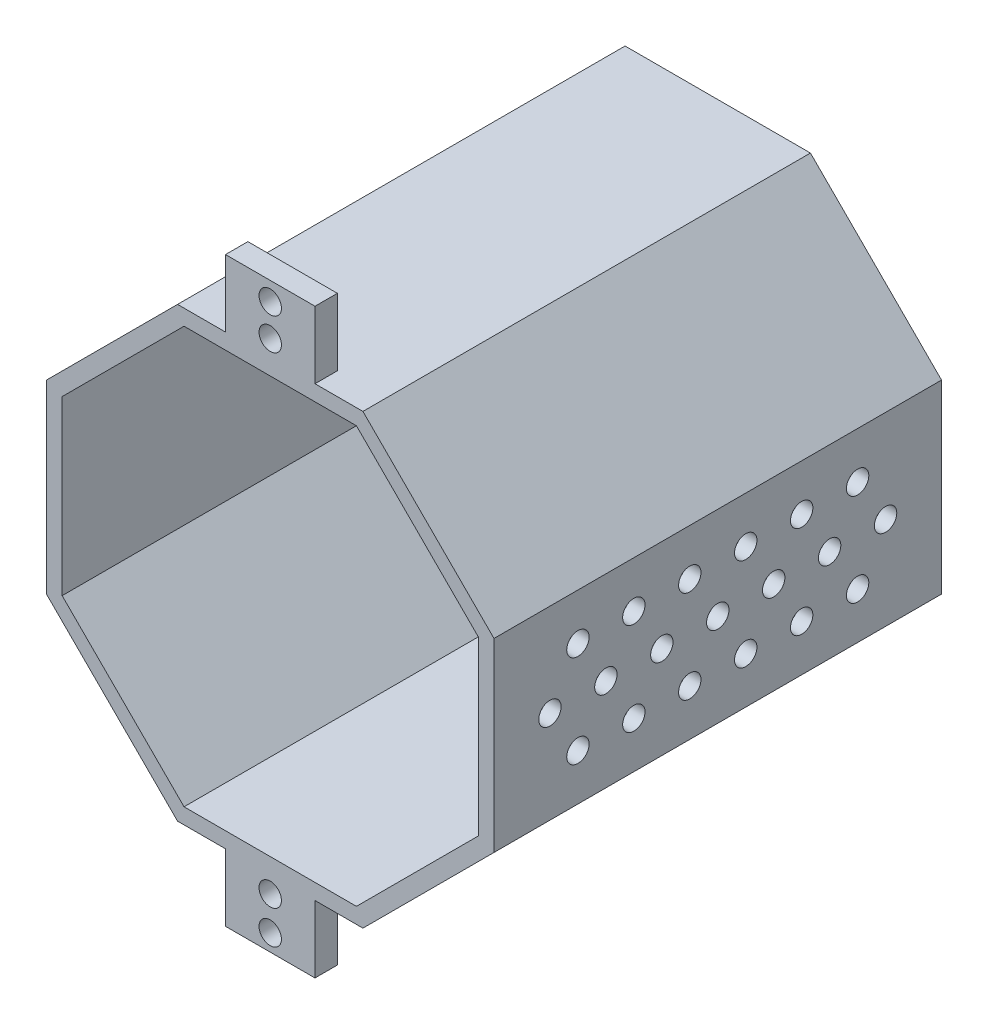
from build123d import *

# Parameters (mm, degrees)
BOSS_EXTRU_1_DEPTH      = 200
ESQUISSE1_4_W           = 180.51591899
ESQUISSE1_4_H           = 60
ESQUISSE1_4_W_2         = 100
ESQUISSE1_4_H_2         = 30
BOSS_EXTRU_2_DEPTH      = 10
ESQUISSE1_5_W           = 180.51591899
ESQUISSE1_5_H           = 60
ESQUISSE1_5_R           = 28.268371714
BOSS_EXTRU_3_DEPTH      = 5
ESQUISSE1_6_W           = 100
ESQUISSE1_6_H           = 30
ESQUISSE1_6_R           = 10.514299466
BOSS_EXTRU_4_DEPTH      = 5
ENL_V_MAT_EXTRU_1_REACH = 302
ESQUISSE6_R             = 5
ESQUISSE7_W             = 40
ESQUISSE7_H             = 10
BOSS_EXTRU_5_DEPTH      = 30
ESQUISSE8_R             = 5
ENL_V_MAT_EXTRU_2_DEPTH = 30
ESQUISSE9_W             = 40
ESQUISSE9_H             = 10
BOSS_EXTRU_6_DEPTH      = 30
ESQUISSE10_R            = 5
ENL_V_MAT_EXTRU_3_DEPTH = 30
ENL_V_START             = -3
ENL_V_MAT_EXTRU_5_DEPTH = 3


# Read off the part's stored shape, not the designer's step: Enlèv. mat.-Extru.5
with BuildPart() as part:
    # Esquisse1 → Boss.-Extru.1 (new body)
    with BuildSketch(Plane.XY):
        Polygon((-41.421356237, 100), (-100, 41.421356237), (-100, -41.421356237), (-41.421356237, -100), (41.421356237, -100), (100, -41.421356237), (100, 41.421356237), (41.421356237, 100), align=None)
        Polygon((-93, -38.521861301), (-38.521861301, -93), (38.521861301, -93), (93, -38.521861301), (93, 38.521861301), (38.521861301, 93), (-38.521861301, 93), (-93, 38.521861301), align=None, mode=Mode.SUBTRACT)
    extrude(amount=BOSS_EXTRU_1_DEPTH)

    # Esquisse1<4> → Boss.-Extru.2 (add)
    with BuildSketch(Plane.XY):
        Polygon((-38.521861301, 93), (-93, 38.521861301), (-93, -38.521861301), (-38.521861301, -93), (38.521861301, -93), (93, -38.521861301), (93, 38.521861301), (38.521861301, 93), align=None)
        Rectangle(ESQUISSE1_4_W, ESQUISSE1_4_H, mode=Mode.SUBTRACT)
        with Locations((0, 53.70858778)):
            Rectangle(ESQUISSE1_4_W_2, ESQUISSE1_4_H_2, mode=Mode.SUBTRACT)
    extrude(amount=BOSS_EXTRU_2_DEPTH)

    # Esquisse1<5> → Boss.-Extru.3 (add)
    with BuildSketch(Plane.XY):
        Rectangle(ESQUISSE1_5_W, ESQUISSE1_5_H)
        with Locations((-46.528984582, 0)):
            Circle(ESQUISSE1_5_R, mode=Mode.SUBTRACT)
    extrude(amount=BOSS_EXTRU_3_DEPTH)

    # Esquisse1<6> → Boss.-Extru.4 (add)
    with BuildSketch(Plane.XY):
        with Locations((0, 53.70858778)):
            Rectangle(ESQUISSE1_6_W, ESQUISSE1_6_H)
        with Locations((0, 55.240316126)):
            Circle(ESQUISSE1_6_R, mode=Mode.SUBTRACT)
    extrude(amount=BOSS_EXTRU_4_DEPTH)

    # Esquisse6 → Enlèv. mat.-Extru.1 (cut, up to next)
    with BuildSketch(Plane(origin=(100, 0, 0), x_dir=(0, 0, -1), z_dir=(1, 0, 0)), mode=Mode.PRIVATE) as enl_v_mat_extru_1_sk1:
        with Locations(Location((-25, 0, 0), (0, 0, 90))):
            Circle(ESQUISSE6_R)
    enl_v_mat_extru_1_tool1 = extrude(enl_v_mat_extru_1_sk1.sketch, amount=-ENL_V_MAT_EXTRU_1_REACH, mode=Mode.PRIVATE) & part.part
    # Esquisse6 → Enlèv. mat.-Extru.1 (cut, up to next)
    with BuildSketch(Plane(origin=(100, 0, 0), x_dir=(0, 0, -1), z_dir=(1, 0, 0)), mode=Mode.PRIVATE) as enl_v_mat_extru_1_sk2:
        with Locations(Location((-50, 0, 0), (0, 0, 90))):
            Circle(ESQUISSE6_R)
    enl_v_mat_extru_1_tool2 = extrude(enl_v_mat_extru_1_sk2.sketch, amount=-ENL_V_MAT_EXTRU_1_REACH, mode=Mode.PRIVATE) & part.part
    # Esquisse6 → Enlèv. mat.-Extru.1 (cut, up to next)
    with BuildSketch(Plane(origin=(100, 0, 0), x_dir=(0, 0, -1), z_dir=(1, 0, 0)), mode=Mode.PRIVATE) as enl_v_mat_extru_1_sk3:
        with Locations(Location((-100, 0, 0), (0, 0, 90))):
            Circle(ESQUISSE6_R)
    enl_v_mat_extru_1_tool3 = extrude(enl_v_mat_extru_1_sk3.sketch, amount=-ENL_V_MAT_EXTRU_1_REACH, mode=Mode.PRIVATE) & part.part
    # Esquisse6 → Enlèv. mat.-Extru.1 (cut, up to next)
    with BuildSketch(Plane(origin=(100, 0, 0), x_dir=(0, 0, -1), z_dir=(1, 0, 0)), mode=Mode.PRIVATE) as enl_v_mat_extru_1_sk4:
        with Locations(Location((-75, 0, 0), (0, 0, 90))):
            Circle(ESQUISSE6_R)
    enl_v_mat_extru_1_tool4 = extrude(enl_v_mat_extru_1_sk4.sketch, amount=-ENL_V_MAT_EXTRU_1_REACH, mode=Mode.PRIVATE) & part.part
    # Esquisse6 → Enlèv. mat.-Extru.1 (cut, up to next)
    with BuildSketch(Plane(origin=(100, 0, 0), x_dir=(0, 0, -1), z_dir=(1, 0, 0)), mode=Mode.PRIVATE) as enl_v_mat_extru_1_sk5:
        with Locations(Location((-125, 0, 0), (0, 0, 90))):
            Circle(ESQUISSE6_R)
    enl_v_mat_extru_1_tool5 = extrude(enl_v_mat_extru_1_sk5.sketch, amount=-ENL_V_MAT_EXTRU_1_REACH, mode=Mode.PRIVATE) & part.part
    # Esquisse6 → Enlèv. mat.-Extru.1 (cut, up to next)
    with BuildSketch(Plane(origin=(100, 0, 0), x_dir=(0, 0, -1), z_dir=(1, 0, 0)), mode=Mode.PRIVATE) as enl_v_mat_extru_1_sk6:
        with Locations(Location((-150, 0, 0), (0, 0, 90))):
            Circle(ESQUISSE6_R)
    enl_v_mat_extru_1_tool6 = extrude(enl_v_mat_extru_1_sk6.sketch, amount=-ENL_V_MAT_EXTRU_1_REACH, mode=Mode.PRIVATE) & part.part
    # Esquisse6 → Enlèv. mat.-Extru.1 (cut, up to next)
    with BuildSketch(Plane(origin=(100, 0, 0), x_dir=(0, 0, -1), z_dir=(1, 0, 0)), mode=Mode.PRIVATE) as enl_v_mat_extru_1_sk7:
        with Locations(Location((-175, 0, 0), (0, 0, 90))):
            Circle(ESQUISSE6_R)
    enl_v_mat_extru_1_tool7 = extrude(enl_v_mat_extru_1_sk7.sketch, amount=-ENL_V_MAT_EXTRU_1_REACH, mode=Mode.PRIVATE) & part.part
    # Esquisse6 → Enlèv. mat.-Extru.1 (cut, up to next)
    with BuildSketch(Plane(origin=(100, 0, 0), x_dir=(0, 0, -1), z_dir=(1, 0, 0)), mode=Mode.PRIVATE) as enl_v_mat_extru_1_sk8:
        with Locations(Location((-162.5, 20.710678119, 0), (0, 0, 90))):
            Circle(ESQUISSE6_R)
    enl_v_mat_extru_1_tool8 = extrude(enl_v_mat_extru_1_sk8.sketch, amount=-ENL_V_MAT_EXTRU_1_REACH, mode=Mode.PRIVATE) & part.part
    # Esquisse6 → Enlèv. mat.-Extru.1 (cut, up to next)
    with BuildSketch(Plane(origin=(100, 0, 0), x_dir=(0, 0, -1), z_dir=(1, 0, 0)), mode=Mode.PRIVATE) as enl_v_mat_extru_1_sk9:
        with Locations(Location((-137.5, 20.710678119, 0), (0, 0, 90))):
            Circle(ESQUISSE6_R)
    enl_v_mat_extru_1_tool9 = extrude(enl_v_mat_extru_1_sk9.sketch, amount=-ENL_V_MAT_EXTRU_1_REACH, mode=Mode.PRIVATE) & part.part
    # Esquisse6 → Enlèv. mat.-Extru.1 (cut, up to next)
    with BuildSketch(Plane(origin=(100, 0, 0), x_dir=(0, 0, -1), z_dir=(1, 0, 0)), mode=Mode.PRIVATE) as enl_v_mat_extru_1_sk10:
        with Locations(Location((-112.5, 20.710678119, 0), (0, 0, 90))):
            Circle(ESQUISSE6_R)
    enl_v_mat_extru_1_tool10 = extrude(enl_v_mat_extru_1_sk10.sketch, amount=-ENL_V_MAT_EXTRU_1_REACH, mode=Mode.PRIVATE) & part.part
    # Esquisse6 → Enlèv. mat.-Extru.1 (cut, up to next)
    with BuildSketch(Plane(origin=(100, 0, 0), x_dir=(0, 0, -1), z_dir=(1, 0, 0)), mode=Mode.PRIVATE) as enl_v_mat_extru_1_sk11:
        with Locations(Location((-87.5, 20.710678119, 0), (0, 0, 90))):
            Circle(ESQUISSE6_R)
    enl_v_mat_extru_1_tool11 = extrude(enl_v_mat_extru_1_sk11.sketch, amount=-ENL_V_MAT_EXTRU_1_REACH, mode=Mode.PRIVATE) & part.part
    # Esquisse6 → Enlèv. mat.-Extru.1 (cut, up to next)
    with BuildSketch(Plane(origin=(100, 0, 0), x_dir=(0, 0, -1), z_dir=(1, 0, 0)), mode=Mode.PRIVATE) as enl_v_mat_extru_1_sk12:
        with Locations(Location((-62.5, 20.710678119, 0), (0, 0, 90))):
            Circle(ESQUISSE6_R)
    enl_v_mat_extru_1_tool12 = extrude(enl_v_mat_extru_1_sk12.sketch, amount=-ENL_V_MAT_EXTRU_1_REACH, mode=Mode.PRIVATE) & part.part
    # Esquisse6 → Enlèv. mat.-Extru.1 (cut, up to next)
    with BuildSketch(Plane(origin=(100, 0, 0), x_dir=(0, 0, -1), z_dir=(1, 0, 0)), mode=Mode.PRIVATE) as enl_v_mat_extru_1_sk13:
        with Locations(Location((-37.5, 20.710678119, 0), (0, 0, 90))):
            Circle(ESQUISSE6_R)
    enl_v_mat_extru_1_tool13 = extrude(enl_v_mat_extru_1_sk13.sketch, amount=-ENL_V_MAT_EXTRU_1_REACH, mode=Mode.PRIVATE) & part.part
    # Esquisse6 → Enlèv. mat.-Extru.1 (cut, up to next)
    with BuildSketch(Plane(origin=(100, 0, 0), x_dir=(0, 0, -1), z_dir=(1, 0, 0)), mode=Mode.PRIVATE) as enl_v_mat_extru_1_sk14:
        with Locations(Location((-162.5, -20.710678119, 0), (0, 0, 90))):
            Circle(ESQUISSE6_R)
    enl_v_mat_extru_1_tool14 = extrude(enl_v_mat_extru_1_sk14.sketch, amount=-ENL_V_MAT_EXTRU_1_REACH, mode=Mode.PRIVATE) & part.part
    # Esquisse6 → Enlèv. mat.-Extru.1 (cut, up to next)
    with BuildSketch(Plane(origin=(100, 0, 0), x_dir=(0, 0, -1), z_dir=(1, 0, 0)), mode=Mode.PRIVATE) as enl_v_mat_extru_1_sk15:
        with Locations(Location((-137.5, -20.710678119, 0), (0, 0, 90))):
            Circle(ESQUISSE6_R)
    enl_v_mat_extru_1_tool15 = extrude(enl_v_mat_extru_1_sk15.sketch, amount=-ENL_V_MAT_EXTRU_1_REACH, mode=Mode.PRIVATE) & part.part
    # Esquisse6 → Enlèv. mat.-Extru.1 (cut, up to next)
    with BuildSketch(Plane(origin=(100, 0, 0), x_dir=(0, 0, -1), z_dir=(1, 0, 0)), mode=Mode.PRIVATE) as enl_v_mat_extru_1_sk16:
        with Locations(Location((-112.5, -20.710678119, 0), (0, 0, 90))):
            Circle(ESQUISSE6_R)
    enl_v_mat_extru_1_tool16 = extrude(enl_v_mat_extru_1_sk16.sketch, amount=-ENL_V_MAT_EXTRU_1_REACH, mode=Mode.PRIVATE) & part.part
    # Esquisse6 → Enlèv. mat.-Extru.1 (cut, up to next)
    with BuildSketch(Plane(origin=(100, 0, 0), x_dir=(0, 0, -1), z_dir=(1, 0, 0)), mode=Mode.PRIVATE) as enl_v_mat_extru_1_sk17:
        with Locations(Location((-87.5, -20.710678119, 0), (0, 0, 90))):
            Circle(ESQUISSE6_R)
    enl_v_mat_extru_1_tool17 = extrude(enl_v_mat_extru_1_sk17.sketch, amount=-ENL_V_MAT_EXTRU_1_REACH, mode=Mode.PRIVATE) & part.part
    # Esquisse6 → Enlèv. mat.-Extru.1 (cut, up to next)
    with BuildSketch(Plane(origin=(100, 0, 0), x_dir=(0, 0, -1), z_dir=(1, 0, 0)), mode=Mode.PRIVATE) as enl_v_mat_extru_1_sk18:
        with Locations(Location((-62.5, -20.710678119, 0), (0, 0, 90))):
            Circle(ESQUISSE6_R)
    enl_v_mat_extru_1_tool18 = extrude(enl_v_mat_extru_1_sk18.sketch, amount=-ENL_V_MAT_EXTRU_1_REACH, mode=Mode.PRIVATE) & part.part
    # Esquisse6 → Enlèv. mat.-Extru.1 (cut, up to next)
    with BuildSketch(Plane(origin=(100, 0, 0), x_dir=(0, 0, -1), z_dir=(1, 0, 0)), mode=Mode.PRIVATE) as enl_v_mat_extru_1_sk19:
        with Locations(Location((-37.5, -20.710678119, 0), (0, 0, 90))):
            Circle(ESQUISSE6_R)
    enl_v_mat_extru_1_tool19 = extrude(enl_v_mat_extru_1_sk19.sketch, amount=-ENL_V_MAT_EXTRU_1_REACH, mode=Mode.PRIVATE) & part.part
    add(enl_v_mat_extru_1_tool1.solids().sort_by_distance((100, 0, 25))[0], mode=Mode.SUBTRACT)
    add(enl_v_mat_extru_1_tool2.solids().sort_by_distance((100, 0, 50))[0], mode=Mode.SUBTRACT)
    add(enl_v_mat_extru_1_tool3.solids().sort_by_distance((100, 0, 100))[0], mode=Mode.SUBTRACT)
    add(enl_v_mat_extru_1_tool4.solids().sort_by_distance((100, 0, 75))[0], mode=Mode.SUBTRACT)
    add(enl_v_mat_extru_1_tool5.solids().sort_by_distance((100, 0, 125))[0], mode=Mode.SUBTRACT)
    add(enl_v_mat_extru_1_tool6.solids().sort_by_distance((100, 0, 150))[0], mode=Mode.SUBTRACT)
    add(enl_v_mat_extru_1_tool7.solids().sort_by_distance((100, 0, 175))[0], mode=Mode.SUBTRACT)
    add(enl_v_mat_extru_1_tool8.solids().sort_by_distance((100, 20.710678, 162.5))[0], mode=Mode.SUBTRACT)
    add(enl_v_mat_extru_1_tool9.solids().sort_by_distance((100, 20.710678, 137.5))[0], mode=Mode.SUBTRACT)
    add(enl_v_mat_extru_1_tool10.solids().sort_by_distance((100, 20.710678, 112.5))[0], mode=Mode.SUBTRACT)
    add(enl_v_mat_extru_1_tool11.solids().sort_by_distance((100, 20.710678, 87.5))[0], mode=Mode.SUBTRACT)
    add(enl_v_mat_extru_1_tool12.solids().sort_by_distance((100, 20.710678, 62.5))[0], mode=Mode.SUBTRACT)
    add(enl_v_mat_extru_1_tool13.solids().sort_by_distance((100, 20.710678, 37.5))[0], mode=Mode.SUBTRACT)
    add(enl_v_mat_extru_1_tool14.solids().sort_by_distance((100, -20.710678, 162.5))[0], mode=Mode.SUBTRACT)
    add(enl_v_mat_extru_1_tool15.solids().sort_by_distance((100, -20.710678, 137.5))[0], mode=Mode.SUBTRACT)
    add(enl_v_mat_extru_1_tool16.solids().sort_by_distance((100, -20.710678, 112.5))[0], mode=Mode.SUBTRACT)
    add(enl_v_mat_extru_1_tool17.solids().sort_by_distance((100, -20.710678, 87.5))[0], mode=Mode.SUBTRACT)
    add(enl_v_mat_extru_1_tool18.solids().sort_by_distance((100, -20.710678, 62.5))[0], mode=Mode.SUBTRACT)
    add(enl_v_mat_extru_1_tool19.solids().sort_by_distance((100, -20.710678, 37.5))[0], mode=Mode.SUBTRACT)

    # Esquisse7 → Boss.-Extru.5 (add)
    with BuildSketch(Plane.XZ.offset(100)):
        with Locations((-0.001356237, 195)):
            Rectangle(ESQUISSE7_W, ESQUISSE7_H)
    extrude(amount=BOSS_EXTRU_5_DEPTH)

    # Esquisse8 → Enlèv. mat.-Extru.2 (cut)
    with BuildSketch(Plane.XY.offset(200)):
        with Locations((-0.001356237, -107.5)):
            Circle(ESQUISSE8_R)
        with Locations((-0.001356237, -122.5)):
            Circle(ESQUISSE8_R)
    extrude(amount=-ENL_V_MAT_EXTRU_2_DEPTH, mode=Mode.SUBTRACT)

    # Esquisse9 → Boss.-Extru.6 (add)
    with BuildSketch(Plane(origin=(0, 100, 0), x_dir=(1, 0, 0), z_dir=(0, 1, 0))):
        with Locations((0.001356237, -195)):
            Rectangle(ESQUISSE9_W, ESQUISSE9_H)
    extrude(amount=BOSS_EXTRU_6_DEPTH)

    # Esquisse10 → Enlèv. mat.-Extru.3 (cut)
    with BuildSketch(Plane.XY.offset(200)):
        with Locations((0.001356237, 121.703107372)):
            Circle(ESQUISSE10_R)
        with Locations((0.001356237, 107.5)):
            Circle(ESQUISSE10_R)
    extrude(amount=-ENL_V_MAT_EXTRU_3_DEPTH, mode=Mode.SUBTRACT)

    # Enlèv. mat.-Extru.5 outline → Enlèv. mat.-Extru.5 (cut)
    # profile 1 of 4: a face of its own
    with BuildSketch(Plane(origin=(0, 0, 0), x_dir=(-1, 0, 0), z_dir=(0, 0, -1)).offset(ENL_V_START)):
        with BuildLine():
            add(Edge.make_bspline(
                [(-3.927655517, -72.569210242), (-4.157775732, -71.997155082), (-4.604308353, -70.887120962), (-5.126239263, -69.225454457), (-5.51052719, -67.633938565), (-5.715360944, -66.348237557), (-5.793393181, -65.364516579), (-5.827316172, -64.672916041), (-5.819418622, -64.017035151), (-5.786464836, -63.39682733), (-5.714703154, -62.810313915), (-5.606120445, -62.260748099), (-5.472099245, -61.744128695), (-5.346973728, -61.422361702), (-5.285828594, -61.265123703)],
                knots=[0, 0, 0, 0, 0.158870961, 0.308278292, 0.448405691, 0.580569501, 0.643253391, 0.702682662, 0.758960478, 0.812228344, 0.862690099, 0.911089222, 0.956551936, 1, 1, 1, 1], degree=3))
            add(Edge.make_bspline(
                [(-2.232943979, -76.036758318), (-2.314234386, -75.895161599), (-2.488770443, -75.59114377), (-2.740389083, -75.094550226), (-3.021271883, -74.537833937), (-3.256091666, -74.042087018), (-3.433705861, -73.637478367), (-3.563538626, -73.370505341), (-3.661432254, -73.137323658), (-3.747587672, -72.946986023), (-3.818605397, -72.797158655), (-3.876023669, -72.687480852), (-3.901098344, -72.611001701), (-3.921376456, -72.57909123), (-3.927655517, -72.569210242)],
                knots=[0, 0, 0, 0, 0.126827711, 0.272307759, 0.432388929, 0.611310977, 0.698381186, 0.775665962, 0.841877961, 0.894815543, 0.93797347, 0.970693113, 0.990925204, 1, 1, 1, 1], degree=3))
            add(Edge.make_bspline(
                [(15.603594483, -86.102864088), (15.197949708, -86.171518378), (14.38855752, -86.308505834), (13.157504324, -86.36061556), (11.926655352, -86.3082967), (10.695520099, -86.138074059), (9.465164616, -85.853276719), (8.232331332, -85.454070076), (7.000226331, -84.933264613), (5.774390481, -84.305445964), (4.578627498, -83.574161356), (3.428853973, -82.756323794), (2.335759321, -81.852826237), (1.310520687, -80.855740182), (0.328471907, -79.783194139), (-0.584911848, -78.615952795), (-1.452887442, -77.368521525), (-1.970320291, -76.485126544), (-2.232943979, -76.036758318)],
                knots=[0, 0, 0, 0, 0.056436175, 0.112608376, 0.168767783, 0.225398628, 0.282973247, 0.341941303, 0.403081365, 0.466426432, 0.530857153, 0.595342439, 0.659994069, 0.725346782, 0.791540134, 0.859491026, 0.928684495, 1, 1, 1, 1], degree=3))
            add(Edge.make_bspline(
                [(18.944940637, -85.087239088), (18.665748597, -85.20079935), (18.114793299, -85.424898246), (17.274559286, -85.699062358), (16.44076475, -85.930705946), (15.880768758, -86.045865159), (15.603594483, -86.102864088)],
                knots=[0, 0, 0, 0, 0.258378622, 0.509882269, 0.757412502, 1, 1, 1, 1], degree=3))
            add(Edge.make_bspline(
                [(26.396863713, -61.854066011), (26.647251931, -62.481488251), (27.137125384, -63.709012059), (27.688220297, -65.573500542), (28.078727092, -67.399577999), (28.298075212, -69.189667347), (28.347833697, -70.944209787), (28.231407868, -72.662374291), (27.931421927, -74.342358987), (27.477738635, -75.970936592), (26.875107613, -77.521998674), (26.132340091, -78.968452364), (25.260606775, -80.296796418), (24.252850424, -81.500561663), (23.123665936, -82.593513559), (21.852308177, -83.553151447), (20.459239009, -84.405377121), (19.45519107, -84.857482277), (18.944940637, -85.087239088)],
                knots=[0, 0, 0, 0, 0.074066715, 0.144908246, 0.212954898, 0.278691883, 0.342437352, 0.405213943, 0.467240036, 0.529295312, 0.590379008, 0.649440588, 0.707335991, 0.764277868, 0.821309551, 0.879319505, 0.938670982, 1, 1, 1, 1], degree=3))
            add(Edge.make_bspline(
                [(7.97739256, -47.557191011), (8.409822165, -47.442071471), (9.26170744, -47.215286255), (10.563573805, -47.068145123), (11.850332132, -47.08346632), (13.122546772, -47.274136951), (14.38118818, -47.627224761), (15.626683099, -48.14186942), (16.85325224, -48.830492055), (18.059552345, -49.68237192), (19.241237287, -50.686758499), (20.386112112, -51.843023923), (21.493076758, -53.14468233), (22.553906593, -54.599477556), (23.583045982, -56.196775201), (24.572740062, -57.942763275), (25.525055757, -59.837684337), (26.101061449, -61.169912741), (26.396863713, -61.854066011)],
                knots=[0, 0, 0, 0, 0.052326792, 0.103083653, 0.1528023, 0.202580637, 0.253217099, 0.305474486, 0.359955898, 0.417530878, 0.478092342, 0.541268242, 0.607806323, 0.677924886, 0.751881546, 0.830122892, 0.912761221, 1, 1, 1, 1], degree=3))
            add(Edge.make_bspline(
                [(6.19253679, -48.24829678), (6.326890361, -48.194567596), (6.575565496, -48.095120206), (6.913503064, -47.954176256), (7.19407721, -47.853449078), (7.465603592, -47.752912141), (7.725555848, -47.671045793), (7.903757727, -47.590481145), (7.97739256, -47.557191011)],
                knots=[0, 0, 0, 0, 0.226747328, 0.419686813, 0.573625466, 0.693771365, 0.873463207, 1, 1, 1, 1], degree=3))
            Line((6.19253679, -48.24829678), (9.14926756, -55.273537165))
            Line((9.14926756, -55.273537165), (10.675709867, -54.774739088))
            add(Edge.make_bspline(
                [(19.732200252, -59.997094857), (19.619381156, -59.743055801), (19.39848069, -59.24564581), (19.016857113, -58.542141318), (18.612025555, -57.88863567), (18.161027715, -57.299109417), (17.690689328, -56.753060703), (17.173306276, -56.273307025), (16.635510171, -55.83651464), (16.059356895, -55.464424905), (15.463304138, -55.142985186), (14.836485067, -54.89721551), (14.193321283, -54.708876293), (13.528625353, -54.589038363), (12.844095348, -54.534189144), (12.1385598, -54.550955113), (11.40919026, -54.617019941), (10.923279226, -54.721504634), (10.675709867, -54.774739088)],
                knots=[0, 0, 0, 0, 0.072519448, 0.141993513, 0.208718091, 0.272920693, 0.3355304, 0.396557146, 0.456815378, 0.516124891, 0.575295981, 0.633255917, 0.691498127, 0.749951148, 0.809216862, 0.870395705, 0.933967228, 1, 1, 1, 1], degree=3))
            add(Edge.make_bspline(
                [(19.834363713, -66.361277549), (19.933864111, -66.106703477), (20.130528298, -65.603533597), (20.330222311, -64.821413313), (20.435029165, -64.032860882), (20.468056901, -63.237703398), (20.411830047, -62.434055651), (20.272801137, -61.622988083), (20.049544487, -60.803478454), (19.839500128, -60.269747864), (19.732200252, -59.997094857)],
                knots=[0, 0, 0, 0, 0.12518361, 0.247427484, 0.368823813, 0.489177706, 0.611559397, 0.737283832, 0.865793053, 1, 1, 1, 1], degree=3))
            add(Edge.make_bspline(
                [(14.257440637, -71.265123703), (14.600452592, -71.113981858), (15.267654488, -70.819991738), (16.201179321, -70.305952801), (17.046785815, -69.755939391), (17.794374373, -69.159203773), (18.451412862, -68.52701671), (19.007069494, -67.847805835), (19.479176153, -67.130822413), (19.716335233, -66.616996558), (19.834363713, -66.361277549)],
                knots=[0, 0, 0, 0, 0.147537089, 0.286978411, 0.419120529, 0.544281369, 0.663097158, 0.777426797, 0.889230567, 1, 1, 1, 1], degree=3))
            add(Edge.make_bspline(
                [(0.134844483, -68.24829678), (0.266944763, -68.54383916), (0.524186561, -69.119355372), (1.00304083, -69.911221053), (1.54101423, -70.612905619), (2.132966745, -71.233027615), (2.784707078, -71.764275463), (3.494367184, -72.208901831), (4.265791936, -72.557119524), (5.095126858, -72.82476659), (5.99312822, -72.994990448), (6.961314297, -73.046611632), (8.001848541, -73.012118101), (9.113823743, -72.858456771), (10.301916487, -72.620013437), (11.556846815, -72.262238347), (12.89135256, -71.82039876), (13.790707797, -71.454837023), (14.257440637, -71.265123703)],
                knots=[0, 0, 0, 0, 0.059046565, 0.114982682, 0.168443944, 0.220165034, 0.271104715, 0.321529987, 0.372581094, 0.425195352, 0.480271547, 0.538889735, 0.601819825, 0.670031968, 0.743534936, 0.822843952, 0.908062419, 1, 1, 1, 1], degree=3))
            add(Edge.make_bspline(
                [(-0.406020902, -66.757912165), (-0.36870609, -66.880344587), (-0.2955594, -67.120343823), (-0.17187019, -67.479346042), (-0.02711792, -67.85314252), (0.078272076, -68.110271984), (0.134844483, -68.24829678)],
                knots=[0, 0, 0, 0, 0.242042567, 0.474466078, 0.717898091, 1, 1, 1, 1], degree=3))
            add(Edge.make_bspline(
                [(2.724988713, -57.77954678), (2.51456921, -57.929044853), (2.104613813, -58.220308453), (1.540959239, -58.691034744), (1.03343018, -59.164991728), (0.585555913, -59.648992159), (0.193148353, -60.138141106), (-0.133875402, -60.643039764), (-0.40561942, -61.152833804), (-0.620845609, -61.675362057), (-0.77034337, -62.218853271), (-0.871684465, -62.784141835), (-0.927020822, -63.379234394), (-0.92534529, -64.00268927), (-0.869041584, -64.653257442), (-0.763752326, -65.331056181), (-0.617217341, -66.038973839), (-0.477554984, -66.514401463), (-0.406020902, -66.757912165)],
                knots=[0, 0, 0, 0, 0.074575657, 0.145294009, 0.212055274, 0.275148512, 0.335729304, 0.393057928, 0.44874041, 0.50249636, 0.55601797, 0.611322939, 0.66829967, 0.728511394, 0.791255687, 0.856841789, 0.926675366, 1, 1, 1, 1], degree=3))
            Line((2.724988713, -57.77954678), (3.644459867, -57.244691011))
            Line((3.644459867, -57.244691011), (0.765854098, -50.411758318))
            Line((0.765854098, -50.411758318), (-10.279818979, -55.039162165))
            Line((-10.279818979, -55.039162165), (-7.821886287, -60.868489088))
            Line((-7.821886287, -60.868489088), (-5.285828594, -61.265123703))
        make_face()
    # profile 2 of 4: a face of its own
    with BuildSketch(Plane(origin=(0, 0, 0), x_dir=(-1, 0, 0), z_dir=(0, 0, -1)).offset(ENL_V_START)):
        with BuildLine():
            add(Edge.make_bspline(
                [(-15.73181456, -28.796713284), (-15.686649207, -28.902377951), (-15.605370511, -29.092530044), (-15.455786809, -29.332263647), (-15.319582281, -29.512122938), (-15.154234896, -29.631770035), (-14.932232842, -29.655413827), (-14.649803431, -29.597928475), (-14.279357531, -29.489717288), (-14.008065358, -29.380461888), (-13.85681456, -29.319549823)],
                knots=[0, 0, 0, 0, 0.145220523, 0.261336047, 0.356786061, 0.429925688, 0.512051337, 0.630034497, 0.793736853, 1, 1, 1, 1], degree=3))
            Line((-15.73181456, -28.796713284), (-17.45056456, -24.722194054))
            Line((-17.45056456, -24.722194054), (-22.065949175, -26.651280592))
            Line((-22.065949175, -26.651280592), (-12.504651098, -49.343588284))
            Line((-12.504651098, -49.343588284), (-7.889266483, -47.414501746))
            Line((-7.889266483, -47.414501746), (-9.367631868, -43.898876746))
            Line((-9.367631868, -43.898876746), (-9.602006868, -43.352001746))
            Line((-9.602006868, -43.352001746), (-9.764266483, -42.967386361))
            add(Edge.make_bspline(
                [(-8.712583791, -41.6152229), (-8.813880413, -41.659011001), (-9.005137854, -41.741687007), (-9.25801496, -41.892929469), (-9.465677355, -42.048342687), (-9.627405109, -42.212048983), (-9.740916071, -42.387400167), (-9.794771006, -42.576987189), (-9.810371153, -42.773038951), (-9.779863899, -42.901637765), (-9.764266483, -42.967386361)],
                knots=[0, 0, 0, 0, 0.174577018, 0.329617643, 0.465386502, 0.584284789, 0.692552859, 0.79190379, 0.893606843, 1, 1, 1, 1], degree=3))
            Line((-8.712583791, -41.6152229), (2.465300825, -36.939742131))
            add(Edge.make_bspline(
                [(7.303041209, -15.809934438), (7.461389523, -16.187698976), (7.772479453, -16.929852403), (8.193898799, -18.034697162), (8.589204281, -19.098204311), (8.935623172, -20.127573328), (9.251376361, -21.117870024), (9.520025954, -22.074873041), (9.756815355, -22.991661827), (9.948899674, -23.8740605), (10.108040879, -24.719184142), (10.219839058, -25.529740696), (10.302664299, -26.303144382), (10.336329767, -27.03947288), (10.340240164, -27.741695071), (10.296815032, -28.405852632), (10.221499175, -29.034903183), (10.100497746, -29.629749087), (9.935464918, -30.1968409), (9.73726012, -30.750931027), (9.491361875, -31.286161099), (9.205239206, -31.810906857), (8.876109955, -32.319409763), (8.501791842, -32.811106569), (8.09076023, -33.291085543), (7.632303731, -33.75203689), (7.132552876, -34.203116882), (6.592042586, -34.641890213), (6.008212559, -35.06337143), (5.378190627, -35.463377416), (4.716138027, -35.864143507), (4.000180055, -36.231411377), (3.252690016, -36.602765154), (2.730889581, -36.826078777), (2.465300825, -36.939742131)],
                knots=[0, 0, 0, 0, 0.048626731, 0.095531717, 0.140375805, 0.183319862, 0.224463914, 0.263763684, 0.301314735, 0.336861701, 0.370960638, 0.403383692, 0.433982134, 0.463269625, 0.490857545, 0.517308771, 0.542235253, 0.566022699, 0.589282363, 0.612303712, 0.635824539, 0.659132788, 0.683210925, 0.707659715, 0.732449675, 0.758180083, 0.784784824, 0.812345051, 0.84079396, 0.870216328, 0.900929164, 0.932630695, 0.965710013, 1, 1, 1, 1], degree=3))
            add(Edge.make_bspline(
                [(5.019387363, -11.032290208), (5.204705037, -11.367255577), (5.594330714, -12.071511712), (6.144295035, -13.212546888), (6.731790354, -14.464969797), (7.107645503, -15.349890809), (7.303041209, -15.809934438)],
                knots=[0, 0, 0, 0, 0.216722591, 0.455653713, 0.717010854, 1, 1, 1, 1], degree=3))
            add(Edge.make_bspline(
                [(-10.287103021, -4.529886361), (-9.892636816, -4.373551732), (-9.126815367, -4.070041798), (-7.972953319, -3.727534856), (-6.860329991, -3.486504847), (-5.783159874, -3.368138946), (-4.745969905, -3.342370779), (-3.748837422, -3.442633189), (-2.789021783, -3.637401679), (-1.865985929, -3.956456554), (-0.963205334, -4.389395371), (-0.077179718, -4.953719563), (0.794885351, -5.652748579), (1.660798556, -6.474872982), (2.523711446, -7.423877297), (3.37208635, -8.507608756), (4.2152671, -9.718507079), (4.745429161, -10.584693399), (5.019387363, -11.032290208)],
                knots=[0, 0, 0, 0, 0.068105326, 0.1322205, 0.193036139, 0.250652497, 0.305987004, 0.359310402, 0.411229892, 0.462904683, 0.5157055, 0.571658278, 0.631187723, 0.694899802, 0.763209158, 0.836956394, 0.915748153, 1, 1, 1, 1], degree=3))
            Line((-10.287103021, -4.529886361), (-22.228208791, -9.529886361))
            add(Edge.make_bspline(
                [(-23.772679945, -9.704165208), (-23.733826213, -9.734126014), (-23.633067006, -9.811823238), (-23.448571066, -9.869365813), (-23.219155447, -9.864727621), (-22.955975123, -9.804369632), (-22.618411119, -9.682668582), (-22.368156931, -9.584682518), (-22.228208791, -9.529886361)],
                knots=[0, 0, 0, 0, 0.089627705, 0.232431127, 0.342569943, 0.507451506, 0.724555076, 1, 1, 1, 1], degree=3))
            Line((-23.772679945, -9.704165208), (-23.892872252, -9.421713284))
            Line((-23.892872252, -9.421713284), (-24.109218406, -8.910895977))
            Line((-24.109218406, -8.910895977), (-25.876045329, -4.722194054))
            Line((-25.876045329, -4.722194054), (-30.491429945, -6.651280592))
            Line((-30.491429945, -6.651280592), (-22.871237637, -24.728203669))
            Line((-22.871237637, -24.728203669), (-18.255853021, -22.799117131))
            Line((-18.255853021, -22.799117131), (-19.824362637, -19.079165208))
            Line((-19.824362637, -19.079165208), (-20.040708791, -18.574357515))
            Line((-20.040708791, -18.574357515), (-20.124843406, -18.370030592))
            add(Edge.make_bspline(
                [(-18.958978021, -17.210174823), (-19.095782532, -17.268919647), (-19.339598907, -17.373616122), (-19.657710965, -17.530615395), (-19.88543694, -17.663104319), (-20.074647338, -17.810247689), (-20.180912886, -18.063607543), (-20.144677373, -18.261636781), (-20.124843406, -18.370030592)],
                knots=[0, 0, 0, 0, 0.243784777, 0.434479246, 0.580173791, 0.675521025, 0.822392324, 1, 1, 1, 1], degree=3))
            Line((-18.958978021, -17.210174823), (-6.404891483, -11.957770977))
            Line((-6.404891483, -11.957770977), (-6.056333791, -11.807530592))
            Line((-6.056333791, -11.807530592), (-4.848401098, -11.3027229))
            add(Edge.make_bspline(
                [(0.932848902, -14.109213284), (0.726177368, -13.785193142), (0.335166619, -13.17216552), (-0.337936023, -12.38465178), (-1.023263226, -11.756059195), (-1.743786755, -11.301799557), (-2.496530839, -11.029111743), (-3.273206161, -10.936734505), (-4.072165569, -11.024089156), (-4.58293201, -11.207431402), (-4.848401098, -11.3027229)],
                knots=[0, 0, 0, 0, 0.162137462, 0.306754827, 0.4361687, 0.55355627, 0.664072498, 0.771421827, 0.881197286, 1, 1, 1, 1], degree=3))
            add(Edge.make_bspline(
                [(2.164820055, -16.507049823), (2.087097953, -16.31764565), (1.926353137, -15.92592003), (1.629256849, -15.340516238), (1.315920216, -14.719512548), (1.062420699, -14.315643705), (0.932848902, -14.109213284)],
                knots=[0, 0, 0, 0, 0.227433894, 0.47037867, 0.729293418, 1, 1, 1, 1], degree=3))
            add(Edge.make_bspline(
                [(-0.389266483, -23.640463284), (-0.193678833, -23.552995479), (0.183655671, -23.384249543), (0.712708321, -23.094819071), (1.180352325, -22.777225577), (1.592071642, -22.438521487), (1.951511501, -22.084540422), (2.249410844, -21.703212217), (2.485612848, -21.295825408), (2.667587707, -20.865796861), (2.794160461, -20.4113423), (2.866235128, -19.931096186), (2.882632994, -19.425231158), (2.84533288, -18.891821589), (2.750785898, -18.332188176), (2.615458721, -17.74182556), (2.412991554, -17.129524705), (2.249138357, -16.718540767), (2.164820055, -16.507049823)],
                knots=[0, 0, 0, 0, 0.073627397, 0.142044538, 0.206977393, 0.267633037, 0.325085329, 0.380040691, 0.43342057, 0.486493142, 0.540121136, 0.595141164, 0.653016888, 0.713750645, 0.778614099, 0.847926249, 0.921743363, 1, 1, 1, 1], degree=3))
            Line((-0.389266483, -23.640463284), (-2.083978021, -24.397674823))
            Line((-2.083978021, -24.397674823), (-13.85681456, -29.319549823))
        make_face()
    # profile 3 of 4: a face of its own
    with BuildSketch(Plane(origin=(0, 0, 0), x_dir=(-1, 0, 0), z_dir=(0, 0, -1)).offset(ENL_V_START)):
        with BuildLine():
            add(Edge.make_bspline(
                [(-42.439025494, 22.52417695), (-42.609935353, 22.932562201), (-42.939389052, 23.719784378), (-43.404504979, 24.859987336), (-43.810665243, 25.920302888), (-44.179458428, 26.892331514), (-44.50001269, 27.783248486), (-44.768822873, 28.591264035), (-44.995123811, 29.315573693), (-45.224033629, 30.157416312), (-45.430847437, 31.129062974), (-45.539744774, 32.240444808), (-45.564652218, 33.288114323), (-45.46309014, 33.955157325), (-45.413785109, 34.278984642)],
                knots=[0, 0, 0, 0, 0.108121014, 0.208419035, 0.300727778, 0.385416382, 0.462325986, 0.531945397, 0.59338097, 0.647617735, 0.745005069, 0.835503031, 0.920142162, 1, 1, 1, 1], degree=3))
            Line((-42.439025494, 22.52417695), (-32.541188956, -0.97942882))
            Line((-32.541188956, -0.97942882), (-27.92580434, 0.949657719))
            Line((-27.92580434, 0.949657719), (-29.866910109, 5.559032719))
            add(Edge.make_bspline(
                [(-29.241910109, 6.869128873), (-29.348960254, 6.825190493), (-29.539718134, 6.746894548), (-29.780116233, 6.616873752), (-29.950771974, 6.520868442), (-30.069696145, 6.42471923), (-30.091902676, 6.2786634), (-30.056895146, 6.09890006), (-29.981988851, 5.849667031), (-29.908694163, 5.664559418), (-29.866910109, 5.559032719)],
                knots=[0, 0, 0, 0, 0.189430504, 0.337555466, 0.444956042, 0.514508584, 0.57496553, 0.674198156, 0.814265916, 1, 1, 1, 1], degree=3))
            add(Edge.make_bspline(
                [(-28.779169725, 7.061436565), (-28.869661513, 7.026209109), (-29.025368313, 6.965594167), (-29.177988056, 6.897604944), (-29.241910109, 6.869128873)],
                knots=[0, 0, 0, 0, 0.581167863, 1, 1, 1, 1], degree=3))
            Line((-28.779169725, 7.061436565), (-12.775563956, 13.756148103))
            add(Edge.make_bspline(
                [(-11.002727417, 13.407590411), (-11.037483041, 13.479730891), (-11.103765383, 13.617309774), (-11.252831472, 13.785458199), (-11.433077311, 13.90414414), (-11.646900882, 13.971679082), (-11.888498706, 13.984220395), (-12.160894407, 13.960737654), (-12.459933262, 13.876740873), (-12.666074996, 13.797980463), (-12.775563956, 13.756148103)],
                knots=[0, 0, 0, 0, 0.116844589, 0.222833949, 0.324554627, 0.429400771, 0.547089544, 0.676716977, 0.828293276, 1, 1, 1, 1], degree=3))
            Line((-11.002727417, 13.407590411), (-9.09767934, 8.888359642))
            Line((-9.09767934, 8.888359642), (-4.482294725, 10.81744618))
            Line((-4.482294725, 10.81744618), (-15.702246648, 37.452061565))
            Line((-15.702246648, 37.452061565), (-16.669794725, 39.747734642))
            add(Edge.make_bspline(
                [(-27.402967802, 47.902782719), (-27.15689459, 47.929890276), (-26.669703386, 47.98355952), (-25.93835361, 47.974653375), (-25.217943241, 47.896062494), (-24.505854054, 47.747306208), (-23.804972103, 47.514023377), (-23.11276201, 47.213065136), (-22.429666443, 46.838613632), (-21.760531334, 46.382596215), (-21.096508352, 45.851283429), (-20.441506375, 45.234669272), (-19.790719781, 44.534362697), (-19.14936134, 43.746789864), (-18.518422816, 42.86870609), (-17.887996814, 41.910001575), (-17.270022232, 40.860058448), (-16.873728567, 40.125658787), (-16.669794725, 39.747734642)],
                knots=[0, 0, 0, 0, 0.051456723, 0.101877254, 0.151757697, 0.202017846, 0.252880655, 0.305132609, 0.358839652, 0.414659807, 0.473357605, 0.53556092, 0.601602434, 0.672082473, 0.746679449, 0.826423083, 0.910676827, 1, 1, 1, 1], degree=3))
            add(Edge.make_bspline(
                [(-29.229890879, 47.440042334), (-29.108164156, 47.485460677), (-28.847450989, 47.582737263), (-28.420672495, 47.708500287), (-27.93204681, 47.814308164), (-27.585531752, 47.872253698), (-27.402967802, 47.902782719)],
                knots=[0, 0, 0, 0, 0.206346097, 0.44195016, 0.705987429, 1, 1, 1, 1], degree=3))
            add(Edge.make_bspline(
                [(-32.844117859, 36.22826038), (-32.870395683, 36.363568554), (-32.964808985, 36.867399859), (-33.092388783, 37.725320776), (-33.208471252, 38.783690929), (-33.238855977, 39.789555227), (-33.22828192, 40.741272025), (-33.141447148, 41.640811764), (-33.002436364, 42.490450883), (-32.788617921, 43.284986587), (-32.52893216, 44.025336141), (-32.206792241, 44.701648286), (-31.842917499, 45.320218309), (-31.417639028, 45.869962338), (-30.946637549, 46.360256339), (-30.427063721, 46.791615664), (-29.852152593, 47.155218923), (-29.438607876, 47.344507793), (-29.229890879, 47.440042334)],
                knots=[0.056737864, 0.056737864, 0.056737864, 0.056737864, 0.087264176, 0.170270206, 0.248756164, 0.322889984, 0.392995978, 0.45938782, 0.522839154, 0.583421707, 0.641374308, 0.696343129, 0.749067817, 0.800000197, 0.849886257, 0.899360324, 0.949206917, 1, 1, 1, 1], degree=3))
            add(Edge.make_bspline(
                [(-35.846477417, 38.762157719), (-35.721269119, 38.691721295), (-35.458979854, 38.544169432), (-35.067042988, 38.277122996), (-34.662137775, 37.954388929), (-34.227511311, 37.598154491), (-33.783844328, 37.18320839), (-33.314672673, 36.730577998), (-33.004318383, 36.401405904), (-32.845304928, 36.229543549), (-32.844117859, 36.22826038)],
                knots=[0, 0, 0, 0, 0.091902707, 0.192519935, 0.303036864, 0.423178324, 0.552005484, 0.691606663, 0.840304528, 0.841423025, 0.841423025, 0.841423025, 0.841423025], degree=3))
            add(Edge.make_bspline(
                [(-41.699842802, 39.447253873), (-41.471498141, 39.534045069), (-41.019163084, 39.705972455), (-40.309371642, 39.845331989), (-39.591204891, 39.901374088), (-38.859871559, 39.864918918), (-38.115279901, 39.729939303), (-37.363043523, 39.497593591), (-36.598574961, 39.17618524), (-36.102521427, 38.903109205), (-35.846477417, 38.762157719)],
                knots=[0, 0, 0, 0, 0.119510652, 0.236742376, 0.352900829, 0.471813439, 0.594459172, 0.722696158, 0.85686628, 1, 1, 1, 1], degree=3))
            add(Edge.make_bspline(
                [(-45.413785109, 34.278984642), (-45.345325825, 34.592909706), (-45.212458086, 35.202184461), (-44.926221632, 36.064834429), (-44.561180967, 36.84085993), (-44.138145108, 37.539303861), (-43.630793515, 38.14739278), (-43.058870049, 38.673549054), (-42.412539265, 39.115213767), (-41.939703642, 39.335504449), (-41.699842802, 39.447253873)],
                knots=[0, 0, 0, 0, 0.1448925, 0.281211513, 0.408966632, 0.531106888, 0.648553115, 0.764969107, 0.880773138, 1, 1, 1, 1], degree=3))
        make_face()
        with BuildLine():
            add(Edge.make_bspline(
                [(-35.888544725, 28.389561565), (-36.017816358, 28.331660808), (-36.26754631, 28.219806779), (-36.613657068, 28.021223462), (-36.91509195, 27.798142505), (-37.175800131, 27.556898685), (-37.397383073, 27.296438325), (-37.569725883, 27.010260351), (-37.713799081, 26.708615892), (-37.802310029, 26.376776766), (-37.850112666, 26.017405825), (-37.853836062, 25.622304545), (-37.8156326, 25.1901877), (-37.737323011, 24.7174805), (-37.605053402, 24.208189203), (-37.446758257, 23.654267139), (-37.232001015, 23.064641363), (-37.067805114, 22.661835765), (-36.982294725, 22.452061565)],
                knots=[0, 0, 0, 0, 0.06112684, 0.118086252, 0.17187855, 0.222667277, 0.271166084, 0.31892678, 0.36652277, 0.414990725, 0.466481431, 0.522700736, 0.585182889, 0.653568533, 0.729287579, 0.812205683, 0.902199962, 1, 1, 1, 1], degree=3))
            add(Edge.make_bspline(
                [(-30.870515879, 26.20807118), (-31.039607459, 26.499200755), (-31.355593877, 27.043243168), (-31.90227745, 27.734921328), (-32.460084873, 28.257208261), (-33.042086434, 28.616542062), (-33.677024695, 28.798328161), (-34.365498368, 28.81379301), (-35.119016988, 28.68065185), (-35.620873544, 28.4908139), (-35.888544725, 28.389561565)],
                knots=[0, 0, 0, 0, 0.162801725, 0.30423238, 0.425023279, 0.53111261, 0.632066493, 0.740729865, 0.861715181, 1, 1, 1, 1], degree=3))
            Line((-30.870515879, 26.20807118), (-30.576044725, 25.510955796))
            Line((-30.576044725, 25.510955796), (-28.893352417, 21.514561565))
            Line((-28.893352417, 21.514561565), (-35.431813956, 18.77417695))
            Line((-35.431813956, 18.77417695), (-36.982294725, 22.452061565))
        make_face(mode=Mode.SUBTRACT)
        with BuildLine():
            add(Edge.make_bspline(
                [(-24.860900494, 34.128744257), (-24.992971621, 34.068072639), (-25.251444133, 33.949334004), (-25.600046817, 33.716761704), (-25.911668384, 33.459513052), (-26.173386883, 33.161315857), (-26.384755364, 32.825358708), (-26.553984001, 32.458050909), (-26.674602182, 32.053151595), (-26.749361884, 31.615525407), (-26.789422525, 31.142420446), (-26.762198683, 30.638101948), (-26.713933387, 30.096539854), (-26.597218978, 29.524822225), (-26.458213234, 28.912238525), (-26.253018905, 28.271327548), (-26.015619696, 27.592685834), (-25.828541089, 27.134764051), (-25.732294725, 26.89917695)],
                knots=[0, 0, 0, 0, 0.053225219, 0.104165508, 0.153172628, 0.201065804, 0.24895898, 0.298268023, 0.348932096, 0.403405127, 0.460876938, 0.522626696, 0.588343804, 0.660099001, 0.7363645, 0.818625372, 0.906688163, 1, 1, 1, 1], degree=3))
            add(Edge.make_bspline(
                [(-23.62892934, 34.48932118), (-23.849047552, 34.443225004), (-24.269218403, 34.355234694), (-24.670053863, 34.201798584), (-24.860900494, 34.128744257)],
                knots=[0, 0, 0, 0, 0.523877874, 1, 1, 1, 1], degree=3))
            add(Edge.make_bspline(
                [(-18.959458186, 31.220090411), (-19.117759246, 31.510173235), (-19.419957464, 32.063944083), (-19.944398862, 32.797898631), (-20.486847978, 33.411339016), (-21.060260668, 33.896702153), (-21.668633833, 34.243881302), (-22.30044125, 34.469561512), (-22.96294664, 34.557536234), (-23.404727483, 34.512285653), (-23.62892934, 34.48932118)],
                knots=[0, 0, 0, 0, 0.16190952, 0.309086803, 0.441229413, 0.562586801, 0.675643198, 0.782811979, 0.889778024, 1, 1, 1, 1], degree=3))
            Line((-18.959458186, 31.220090411), (-18.484698571, 30.090282719))
            Line((-18.484698571, 30.090282719), (-16.970275494, 26.502542334))
            Line((-16.970275494, 26.502542334), (-24.277967802, 23.443648103))
            Line((-24.277967802, 23.443648103), (-25.732294725, 26.89917695))
        make_face(mode=Mode.SUBTRACT)
    # profile 4 of 4: a face of its own
    with BuildSketch(Plane(origin=(0, 0, 0), x_dir=(-1, 0, 0), z_dir=(0, 0, -1)).offset(ENL_V_START)):
        with BuildLine():
            add(Edge.make_bspline(
                [(-54.615284277, 65.078422109), (-54.597549575, 65.048455229), (-54.560891742, 64.986513346), (-54.461276718, 64.930295084), (-54.317790726, 64.934373119), (-54.113608496, 64.952683607), (-53.811974901, 65.007384704), (-53.577639305, 65.04490871), (-53.443409277, 65.066402878)],
                knots=[0, 0, 0, 0, 0.083414466, 0.172418658, 0.259823843, 0.425308784, 0.670810497, 1, 1, 1, 1], degree=3))
            Line((-54.615284277, 65.078422109), (-54.993890046, 65.985874032))
            Line((-54.993890046, 65.985874032), (-56.736678507, 70.120489416))
            Line((-56.736678507, 70.120489416), (-61.352063123, 68.191402878))
            Line((-61.352063123, 68.191402878), (-51.490284277, 44.777941339))
            Line((-51.490284277, 44.777941339), (-46.874899661, 46.707027878))
            Line((-46.874899661, 46.707027878), (-48.545572738, 50.679383647))
            Line((-48.545572738, 50.679383647), (-48.779947738, 51.226258647))
            Line((-48.779947738, 51.226258647), (-48.930188123, 51.58683557))
            add(Edge.make_bspline(
                [(-47.896534277, 52.902941339), (-48.001825109, 52.857047143), (-48.198559578, 52.771294471), (-48.458880156, 52.618426797), (-48.67378112, 52.468047545), (-48.826741233, 52.298383544), (-48.942558133, 52.133978388), (-48.992020606, 51.952821855), (-48.994585508, 51.766475992), (-48.9521715, 51.648159536), (-48.930188123, 51.58683557)],
                knots=[0, 0, 0, 0, 0.183505992, 0.342878414, 0.482580981, 0.600483385, 0.707138873, 0.800445234, 0.896569842, 1, 1, 1, 1], degree=3))
            Line((-47.896534277, 52.902941339), (-32.9446112, 59.16496057))
            Line((-32.9446112, 59.16496057), (-31.790765046, 59.645729801))
            add(Edge.make_bspline(
                [(-29.993890046, 59.273133647), (-30.037929272, 59.346613596), (-30.121439235, 59.485950918), (-30.271424649, 59.663186851), (-30.436103962, 59.794154784), (-30.621062942, 59.879221745), (-30.843136815, 59.908115243), (-31.112080665, 59.87708343), (-31.43683304, 59.789822781), (-31.665588876, 59.696691587), (-31.790765046, 59.645729801)],
                knots=[0, 0, 0, 0, 0.122497066, 0.232286674, 0.330368193, 0.421496843, 0.52003835, 0.646725964, 0.80668694, 1, 1, 1, 1], degree=3))
            Line((-29.993890046, 59.273133647), (-29.813601584, 58.840441339))
            Line((-29.813601584, 58.840441339), (-29.5852362, 58.299575955))
            Line((-29.5852362, 58.299575955), (-28.046774661, 54.645729801))
            Line((-28.046774661, 54.645729801), (-23.431390046, 56.574816339))
            Line((-23.431390046, 56.574816339), (-33.2571112, 79.892124032))
            Line((-33.2571112, 79.892124032), (-37.872495815, 77.963037493))
            Line((-37.872495815, 77.963037493), (-36.075620815, 73.69621057))
            Line((-36.075620815, 73.69621057), (-35.841245815, 73.14933557))
            Line((-35.841245815, 73.14933557), (-35.709034277, 72.830825955))
            add(Edge.make_bspline(
                [(-36.959034277, 71.929383647), (-36.800499237, 71.996745867), (-36.521583466, 72.115258376), (-36.162608602, 72.278242144), (-35.926886033, 72.416340692), (-35.762457186, 72.531248964), (-35.679889314, 72.679503331), (-35.700091671, 72.78439534), (-35.709034277, 72.830825955)],
                knots=[0, 0, 0, 0, 0.313480384, 0.551516075, 0.71654478, 0.809899113, 0.915851541, 1, 1, 1, 1], degree=3))
            Line((-36.959034277, 71.929383647), (-53.094851584, 65.18058557))
            Line((-53.094851584, 65.18058557), (-53.443409277, 65.066402878))
        make_face()
    extrude(amount=ENL_V_MAT_EXTRU_5_DEPTH, mode=Mode.SUBTRACT)


solid = part.part
